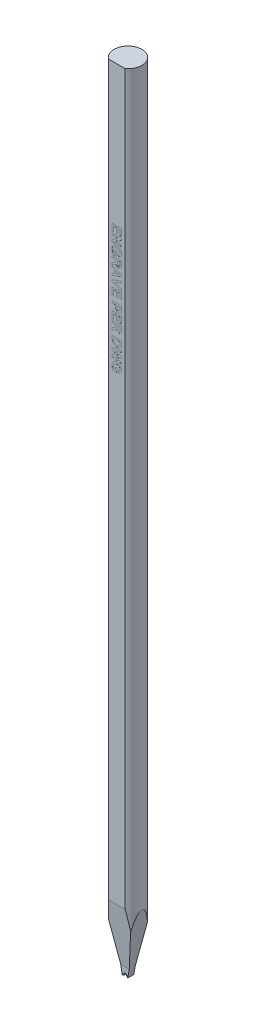
from build123d import *

# Parameters (mm, degrees)
SKETCH_TL_CUTTING_R       = 1.4986
TL_CUTTING_DEPTH          = 85.4964
SKETCH_TDF_GRINDING_W     = 3.0172
SKETCH_TDF_GRINDING_H     = 3.0172
TDF_GRINDING_DEPTH        = 86.522663762
ENGRAVING_DEPTH           = 0.005
VW_VR_GRINDING_DEPTH      = 1.5086
VW_VR_GRINDING_DEPTH_BACK = 1.5086
ISA_GRINDING_DEPTH        = 1.5086
ISA_GRINDING_DEPTH_BACK   = 1.5086
PRE_FRX_BRX_DEPTH         = 1.5086
PRE_FRX_BRX_DEPTH_BACK    = 1.5086
SKETCH_PRE_FRX_BRX_W      = 1.18348
SKETCH_PRE_FRX_BRX_H      = 0.89916
FR_EDM_R                  = 0.14986
BR_EDM_R                  = 0.14986
FA_BA_GRINDING_DEPTH      = 1.5086
FA_BA_GRINDING_DEPTH_BACK = 1.5086


with BuildPart() as part:
    # sketch_TL_cutting → TL_cutting (new body)
    with BuildSketch(Plane(origin=(0, 0, 0), x_dir=(1, 0, 0), z_dir=(0, 1, 0))):
        Circle(SKETCH_TL_CUTTING_R)
    extrude(amount=TL_CUTTING_DEPTH)

    # sketch_TDF_grinding → TDF_grinding (cut, through all)
    with BuildSketch(Plane(origin=(0, 0, 0), x_dir=(1, 0, 0), z_dir=(0, 1, 0))):
        with Locations((0, -2.71002)):
            Rectangle(SKETCH_TDF_GRINDING_W, SKETCH_TDF_GRINDING_H)
    extrude(amount=TDF_GRINDING_DEPTH, mode=Mode.SUBTRACT)

    # sketch_engraving → engraving (cut)
    # profile 1 of 13: a face of its own
    with BuildSketch(Plane.XY.offset(1.20142)):
        Polygon((-0.5, 70.393835897), (0.5, 70.393835897), (0.5, 69.650246154), (0.333333333, 69.650246154), (0.333333333, 70.201528205), (0.115384615, 70.201528205), (0.115384615, 69.688707692), (-0.051282051, 69.688707692), (-0.051282051, 70.201528205), (-0.333333333, 70.201528205), (-0.333333333, 69.637425641), (-0.5, 69.637425641), align=None)
    # profile 2 of 13: a face of its own
    with BuildSketch(Plane.XY.offset(1.20142)):
        Polygon((-0.5, 69.470758974), (0.5, 69.470758974), (0.5, 69.2698375), (-0.157451923, 68.868194872), (0.5, 68.868194872), (0.5, 68.675887179), (-0.5, 68.675887179), (-0.5, 68.88301859), (0.147035256, 69.278451282), (-0.5, 69.278451282), align=None)
    # profile 3 of 13: a face of its own
    with BuildSketch(Plane.XY.offset(1.20142)):
        with BuildLine():
            Line((-0.128205128, 68.022041026), (0.038461538, 68.022041026))
            Line((0.038461538, 68.022041026), (0.038461538, 67.58614359))
            Line((0.038461538, 67.58614359), (-0.36338141, 67.58614359))
            add(Edge.make_bspline(
                [(-0.36338141, 67.58614359), (-0.368321434, 67.591629605), (-0.378419843, 67.602844131), (-0.392661125, 67.621141895), (-0.406257259, 67.64128601), (-0.4194836, 67.6631547), (-0.432233696, 67.686793223), (-0.444685123, 67.712107295), (-0.45671611, 67.739143622), (-0.471787381, 67.777376941), (-0.488186169, 67.826591061), (-0.502445448, 67.886756306), (-0.511191227, 67.947397498), (-0.512277771, 67.987958306), (-0.512820513, 68.00821891)],
                knots=[0, 0, 0, 0, 0.581799769, 1.189316438, 1.825828404, 2.496525428, 3.203088405, 3.942228803, 4.719818701, 5.534979611, 7.181138583, 8.803804008, 10.403462225, 12, 12, 12, 12], degree=3))
            add(Edge.make_bspline(
                [(-0.512820513, 68.00821891), (-0.512629241, 68.020911396), (-0.512252188, 68.045932062), (-0.509233571, 68.082870349), (-0.504017902, 68.118587455), (-0.496780719, 68.153019967), (-0.487836372, 68.186270877), (-0.476607913, 68.218223396), (-0.463065488, 68.248843299), (-0.447986133, 68.278359812), (-0.430657849, 68.306212408), (-0.411724289, 68.332456254), (-0.390891397, 68.356836635), (-0.36853351, 68.379565448), (-0.344060025, 68.400214033), (-0.318106216, 68.419295872), (-0.290219674, 68.436354268), (-0.260879177, 68.45168079), (-0.230317098, 68.465310173), (-0.198781008, 68.476812477), (-0.166726875, 68.486896153), (-0.134042675, 68.495183938), (-0.10062201, 68.501270885), (-0.066619552, 68.50600276), (-0.031822841, 68.508544234), (-0.008417054, 68.508993556), (0.003405449, 68.509220513)],
                knots=[0, 0, 0, 0, 1.124897971, 2.217508473, 3.282174662, 4.322209414, 5.334422951, 6.332119154, 7.320662553, 8.300074908, 9.267468154, 10.225199689, 11.165658754, 12.107290334, 13.047749399, 14.00069605, 14.959944213, 15.942088746, 16.933021067, 17.923599838, 18.915715637, 19.910475908, 20.909926025, 21.925232038, 22.952013513, 24, 24, 24, 24], degree=3))
            add(Edge.make_bspline(
                [(0.003405449, 68.509220513), (0.016165747, 68.509036614), (0.041321811, 68.508674069), (0.078501182, 68.505544425), (0.114594914, 68.50069647), (0.149519517, 68.493301478), (0.183523729, 68.484448027), (0.216299841, 68.473103339), (0.248180515, 68.460149892), (0.278688999, 68.444865774), (0.308028284, 68.427983202), (0.335510174, 68.408799631), (0.361403632, 68.38798003), (0.385591047, 68.365337199), (0.407627145, 68.340498237), (0.428063784, 68.313972539), (0.447146094, 68.28577769), (0.457908016, 68.265600967), (0.463341346, 68.255414423)],
                knots=[0, 0, 0, 0, 1.105132952, 2.178694671, 3.229818344, 4.257558797, 5.269123684, 6.27148554, 7.259679084, 8.247804916, 9.224967877, 10.189258471, 11.147685264, 12.101072275, 13.055511435, 14.02039165, 15.000562851, 16, 16, 16, 16], degree=3))
            add(Edge.make_bspline(
                [(0.463341346, 68.255414423), (0.467347168, 68.247327072), (0.475455657, 68.230956849), (0.485329628, 68.204883756), (0.494054347, 68.177516179), (0.500719187, 68.148534703), (0.506115234, 68.118248224), (0.510216979, 68.086507147), (0.512307439, 68.053252939), (0.512647258, 68.030590515), (0.512820513, 68.019036218)],
                knots=[0, 0, 0, 0, 0.887950456, 1.797368171, 2.741221183, 3.713797788, 4.722103116, 5.768966405, 6.862521341, 8, 8, 8, 8], degree=3))
            add(Edge.make_bspline(
                [(0.512820513, 68.019036218), (0.512598613, 68.004138718), (0.512167059, 67.975165835), (0.508571106, 67.932925541), (0.502373597, 67.893171904), (0.493837942, 67.855849565), (0.482863355, 67.821038928), (0.469371425, 67.788799918), (0.453633675, 67.75893466), (0.435019378, 67.731875716), (0.414494937, 67.707073149), (0.392035387, 67.68459168), (0.367607461, 67.664422262), (0.341334074, 67.646551549), (0.313106625, 67.631120198), (0.283182558, 67.617852182), (0.251334696, 67.606931), (0.22921692, 67.601653034), (0.217948718, 67.598964103)],
                knots=[0, 0, 0, 0, 1.271135529, 2.472123572, 3.614091059, 4.701890498, 5.736279567, 6.724681829, 7.680621489, 8.611506429, 9.52200816, 10.424540711, 11.318996785, 12.221421405, 13.131851814, 14.060431888, 15.011860567, 16, 16, 16, 16], degree=3))
            Line((0.217948718, 67.598964103), (0.179487179, 67.791271795))
            add(Edge.make_bspline(
                [(0.179487179, 67.791271795), (0.185798707, 67.793174377), (0.198251232, 67.796928136), (0.216108293, 67.804234712), (0.232994438, 67.812552834), (0.248643132, 67.822379827), (0.263649233, 67.832817482), (0.277161531, 67.845087665), (0.290187329, 67.857994684), (0.301701762, 67.87248584), (0.312086782, 67.887924395), (0.321450083, 67.904145863), (0.329043783, 67.921514205), (0.335153652, 67.939786828), (0.340342569, 67.958874233), (0.343533767, 67.979025571), (0.345940549, 68.00001453), (0.346081986, 68.014354556), (0.346153846, 68.021640385)],
                knots=[0, 0, 0, 0, 1.027780279, 2.027791312, 3.006028774, 3.96000864, 4.908113241, 5.852721087, 6.802883308, 7.765918715, 8.733730415, 9.704005314, 10.683351261, 11.68471758, 12.707948499, 13.764514378, 14.864202456, 16, 16, 16, 16], degree=3))
            add(Edge.make_bspline(
                [(0.346153846, 68.021640385), (0.345859633, 68.032667741), (0.34528545, 68.054188568), (0.341538784, 68.085606107), (0.334873123, 68.115245672), (0.325679114, 68.14318477), (0.313877959, 68.169474621), (0.299029501, 68.193759968), (0.282012344, 68.216645501), (0.262039987, 68.237479978), (0.239645267, 68.256374481), (0.214561065, 68.272731053), (0.186868462, 68.28634783), (0.156706511, 68.297500746), (0.124073954, 68.306380847), (0.088855272, 68.312404995), (0.051104495, 68.316341063), (0.02505068, 68.316718323), (0.01161859, 68.316912821)],
                knots=[0, 0, 0, 0, 1.043810997, 2.037086103, 2.989314757, 3.91471467, 4.817033861, 5.710208705, 6.603920097, 7.511448416, 8.435617211, 9.371747005, 10.338444094, 11.350425613, 12.411431869, 13.5347293, 14.729025275, 16, 16, 16, 16], degree=3))
            add(Edge.make_bspline(
                [(0.01161859, 68.316912821), (-0.002813331, 68.316710147), (-0.03086261, 68.316316238), (-0.071503034, 68.312481337), (-0.109371212, 68.306183116), (-0.14440027, 68.297115757), (-0.176807311, 68.285808494), (-0.206438048, 68.271828966), (-0.233109204, 68.25502113), (-0.256980675, 68.235958295), (-0.278169336, 68.214921484), (-0.296147735, 68.191858524), (-0.31184176, 68.167600317), (-0.32420794, 68.141460517), (-0.33413508, 68.113912028), (-0.341078682, 68.084685999), (-0.345395871, 68.053887729), (-0.345897627, 68.032806176), (-0.346153846, 68.022041026)],
                knots=[0, 0, 0, 0, 1.31821493, 2.562027667, 3.72541598, 4.821825939, 5.863743127, 6.857000185, 7.808227391, 8.737146514, 9.643023621, 10.529087527, 11.404035307, 12.277173472, 13.164790074, 14.074766194, 15.016892606, 16, 16, 16, 16], degree=3))
            add(Edge.make_bspline(
                [(-0.346153846, 68.022041026), (-0.345850315, 68.011137735), (-0.34524035, 67.989226847), (-0.340086045, 67.956405767), (-0.332449955, 67.923405514), (-0.321065283, 67.891013163), (-0.307937779, 67.859626456), (-0.292687307, 67.830460255), (-0.276962331, 67.803067677), (-0.264654274, 67.7865552), (-0.258613782, 67.778451282)],
                knots=[0, 0, 0, 0, 0.993779204, 1.997065276, 3.023588959, 4.078879359, 5.123947549, 6.123456565, 7.079038607, 8, 8, 8, 8], degree=3))
            Line((-0.258613782, 67.778451282), (-0.128205128, 67.778451282))
            Line((-0.128205128, 67.778451282), (-0.128205128, 68.022041026))
        make_face()
    # profile 4 of 13: a face of its own
    with BuildSketch(Plane.XY.offset(1.20142)):
        with BuildLine():
            Line((-0.5, 67.393835897), (0.5, 67.393835897))
            Line((0.5, 67.393835897), (0.5, 66.974164423))
            add(Edge.make_bspline(
                [(0.5, 66.974164423), (0.499921351, 66.961410201), (0.499769781, 66.936830481), (0.498665723, 66.901283268), (0.496349389, 66.868501265), (0.493735057, 66.838336822), (0.489890849, 66.810877094), (0.485377151, 66.786056079), (0.480042652, 66.763953829), (0.473762142, 66.7443266), (0.46640441, 66.726499938), (0.457825047, 66.709835326), (0.447696774, 66.694175272), (0.436444977, 66.679314477), (0.424039539, 66.665195254), (0.410155618, 66.652203274), (0.394999014, 66.640112567), (0.378696089, 66.628932781), (0.361318758, 66.619084096), (0.343425117, 66.610084982), (0.324824746, 66.602759364), (0.305605269, 66.59670847), (0.285808412, 66.591874923), (0.265383845, 66.588520032), (0.244368538, 66.586425611), (0.230173307, 66.586238641), (0.222956731, 66.58614359)],
                knots=[0, 0, 0, 0, 1.675792322, 3.229558513, 4.671612708, 5.993327294, 7.206773438, 8.313218507, 9.306927966, 10.191988363, 11.018030861, 11.838135071, 12.650980327, 13.465150207, 14.285535933, 15.117196726, 15.959844754, 16.83101188, 17.711363548, 18.582398133, 19.460517458, 20.334551361, 21.228266118, 22.135486512, 23.052118027, 24, 24, 24, 24], degree=3))
            add(Edge.make_bspline(
                [(0.222956731, 66.58614359), (0.213865176, 66.58631771), (0.196097772, 66.586657988), (0.170067915, 66.589859374), (0.145135532, 66.594460931), (0.121515047, 66.601574247), (0.099028777, 66.610418829), (0.077834712, 66.621224821), (0.057734109, 66.633977691), (0.039011166, 66.648743067), (0.021628172, 66.665461702), (0.005964946, 66.684227919), (-0.008142217, 66.704917705), (-0.020271369, 66.727700383), (-0.030960543, 66.752183224), (-0.039742833, 66.778688699), (-0.046961528, 66.80708005), (-0.050349413, 66.826834525), (-0.052083333, 66.836944872)],
                knots=[0, 0, 0, 0, 1.059179627, 2.069928931, 3.052909591, 4.01082991, 4.940120368, 5.865982481, 6.779263376, 7.710344595, 8.640547144, 9.585223395, 10.554458868, 11.553878165, 12.589111246, 13.664634927, 14.804759383, 16, 16, 16, 16], degree=3))
            add(Edge.make_bspline(
                [(-0.052083333, 66.836944872), (-0.058543192, 66.827154557), (-0.071157156, 66.808037315), (-0.092244136, 66.781740986), (-0.113935974, 66.757782324), (-0.13350323, 66.739795798), (-0.150629326, 66.725961316), (-0.165615492, 66.714828495), (-0.182859981, 66.702817912), (-0.202374991, 66.69004991), (-0.22398696, 66.676146224), (-0.248026974, 66.661624206), (-0.274260457, 66.646179885), (-0.292585876, 66.635796031), (-0.302083333, 66.630414423)],
                knots=[0, 0, 0, 0, 1.285482994, 2.510122655, 3.691653098, 4.826411195, 5.419869803, 6.105175889, 6.872935239, 7.723789235, 8.662129684, 9.690525463, 10.803075916, 12, 12, 12, 12], degree=3))
            Line((-0.302083333, 66.630414423), (-0.5, 66.509220513))
            Line((-0.5, 66.509220513), (-0.5, 66.733980128))
            Line((-0.5, 66.733980128), (-0.273036859, 66.876207692))
            add(Edge.make_bspline(
                [(-0.273036859, 66.876207692), (-0.263945443, 66.882737401), (-0.24658806, 66.895203957), (-0.221949287, 66.91323509), (-0.199893124, 66.929636608), (-0.1805544, 66.944427372), (-0.163731826, 66.957427709), (-0.149845803, 66.969082343), (-0.138230202, 66.978819639), (-0.126725879, 66.989854127), (-0.114887633, 67.002680533), (-0.103494307, 67.018542305), (-0.094238036, 67.034723543), (-0.087286311, 67.05222809), (-0.082478883, 67.072519627), (-0.079343719, 67.096879092), (-0.077067211, 67.126032144), (-0.076973557, 67.147102303), (-0.076923077, 67.158459295)],
                knots=[0, 0, 0, 0, 1.465382114, 2.797715724, 3.99708711, 5.063614826, 5.985194575, 6.779875669, 7.43696127, 7.968700361, 8.866038685, 9.717629234, 10.520014012, 11.30082289, 12.174340694, 13.242479345, 14.513673363, 16, 16, 16, 16], degree=3))
            Line((-0.076923077, 67.158459295), (-0.076923077, 67.201528205))
            Line((-0.076923077, 67.201528205), (-0.5, 67.201528205))
            Line((-0.5, 67.201528205), (-0.5, 67.393835897))
        make_face()
        with BuildLine():
            Line((0.08974359, 67.201528205), (0.08974359, 67.046680449))
            add(Edge.make_bspline(
                [(0.08974359, 67.046680449), (0.089768957, 67.0347274), (0.089817287, 67.011954821), (0.090527354, 66.979571991), (0.091115821, 66.950709113), (0.09265079, 66.925409153), (0.094114881, 66.903619334), (0.096069001, 66.885367128), (0.09836301, 66.870628848), (0.101931469, 66.855907986), (0.108148092, 66.840828202), (0.117003495, 66.824758518), (0.128487921, 66.811015466), (0.141777239, 66.799142986), (0.157332372, 66.789978485), (0.174706183, 66.783257484), (0.193862841, 66.779243774), (0.20724563, 66.778720802), (0.214142628, 66.778451282)],
                knots=[0, 0, 0, 0, 1.698120923, 3.235207303, 4.601799022, 5.7989489, 6.835765357, 7.704239165, 8.40605236, 8.953649664, 9.852072573, 10.714567413, 11.550246753, 12.383769498, 13.234656382, 14.099651817, 15.020630301, 16, 16, 16, 16], degree=3))
            add(Edge.make_bspline(
                [(0.214142628, 66.778451282), (0.221852989, 66.77878604), (0.236728888, 66.7794319), (0.257822961, 66.784686949), (0.27662771, 66.793434428), (0.292813882, 66.805923618), (0.306623576, 66.82152236), (0.317392842, 66.840246681), (0.325576055, 66.861691747), (0.328565774, 66.877145804), (0.330128205, 66.885222115)],
                knots=[0, 0, 0, 0, 1.062451802, 2.049829439, 2.976851779, 3.903462222, 4.849641532, 5.832195941, 6.867102576, 8, 8, 8, 8], degree=3))
            add(Edge.make_bspline(
                [(0.330128205, 66.885222115), (0.330421459, 66.887891011), (0.331116534, 66.894216853), (0.331562949, 66.905387541), (0.332249138, 66.919670698), (0.332529569, 66.937239208), (0.333021138, 66.957936115), (0.333111403, 66.981843719), (0.333399792, 67.008886063), (0.333356297, 67.027983752), (0.333333333, 67.038066667)],
                knots=[0, 0, 0, 0, 0.42127143, 0.998501726, 1.753681744, 2.66564073, 3.755712164, 5.002818897, 6.417592707, 8, 8, 8, 8], degree=3))
            Line((0.333333333, 67.038066667), (0.333333333, 67.201528205))
            Line((0.333333333, 67.201528205), (0.08974359, 67.201528205))
        make_face(mode=Mode.SUBTRACT)
    # profile 5 of 13: a face of its own
    with BuildSketch(Plane.XY.offset(1.20142)):
        Polygon((-0.5, 65.534861538), (-0.5, 65.738787821), (-0.269230769, 65.823122756), (-0.269230769, 66.206936859), (-0.5, 66.291271795), (-0.5, 66.4964), (0.5, 66.118395192), (0.5, 65.914669231), align=None)
        Polygon((-0.102564103, 65.884220513), (0.256410256, 66.015630769), (-0.102564103, 66.146640385), align=None, mode=Mode.SUBTRACT)
    # profile 6 of 13: a face of its own
    with BuildSketch(Plane.XY.offset(1.20142)):
        Polygon((-0.5, 65.126608333), (0.5, 65.4964), (0.5, 65.293275), (-0.243589744, 65.028451282), (0.5, 64.764629167), (0.5, 64.560502564), (-0.5, 64.928891987), align=None)
    # profile 7 of 13: a face of its own
    with BuildSketch(Plane.XY.offset(1.20142)):
        Polygon((-0.5, 64.470758974), (0.5, 64.470758974), (0.5, 63.727169231), (0.333333333, 63.727169231), (0.333333333, 64.278451282), (0.115384615, 64.278451282), (0.115384615, 63.765630769), (-0.051282051, 63.765630769), (-0.051282051, 64.278451282), (-0.333333333, 64.278451282), (-0.333333333, 63.714348718), (-0.5, 63.714348718), align=None)
    # profile 8 of 13: a face of its own
    with BuildSketch(Plane.XY.offset(1.20142)):
        with BuildLine():
            Line((-0.5, 63.163066667), (0.5, 63.163066667))
            Line((0.5, 63.163066667), (0.5, 62.843154808))
            add(Edge.make_bspline(
                [(0.5, 62.843154808), (0.4999852, 62.828664455), (0.499956962, 62.801016693), (0.499104777, 62.761484062), (0.497929464, 62.725889855), (0.496434625, 62.694222803), (0.494248137, 62.666566334), (0.491629455, 62.642858956), (0.488933209, 62.622991744), (0.486060508, 62.611234128), (0.484775641, 62.605975321)],
                knots=[0, 0, 0, 0, 1.460492613, 2.786636817, 3.985312262, 5.05006335, 5.98179196, 6.7807735, 7.454678796, 8, 8, 8, 8], degree=3))
            add(Edge.make_bspline(
                [(0.484775641, 62.605975321), (0.482781564, 62.598981959), (0.478823789, 62.585101776), (0.470386441, 62.565215803), (0.460608006, 62.54604887), (0.448953875, 62.527841805), (0.435630967, 62.510532663), (0.420747869, 62.494070188), (0.404237636, 62.478365844), (0.386131953, 62.463639765), (0.366525691, 62.450143742), (0.345376234, 62.438512401), (0.322847402, 62.428651925), (0.298873329, 62.420727517), (0.273610941, 62.414175617), (0.246834559, 62.409993024), (0.218752408, 62.406969504), (0.199528035, 62.4067623), (0.189703526, 62.40665641)],
                knots=[0, 0, 0, 0, 0.907183394, 1.800546498, 2.691728384, 3.591410291, 4.495216108, 5.416087871, 6.359626967, 7.337496937, 8.327236581, 9.327316132, 10.346534403, 11.393207653, 12.477041209, 13.600953845, 14.773980723, 16, 16, 16, 16], degree=3))
            add(Edge.make_bspline(
                [(0.189703526, 62.40665641), (0.174784734, 62.406964918), (0.146065241, 62.407558813), (0.104894137, 62.414208263), (0.067280604, 62.424341168), (0.03361575, 62.439182122), (0.003633111, 62.457195209), (-0.023091697, 62.477363014), (-0.046492635, 62.499846245), (-0.066210989, 62.524425478), (-0.082434, 62.550356803), (-0.096247437, 62.576355341), (-0.106871469, 62.602746515), (-0.11149992, 62.62074078), (-0.113782051, 62.629613141)],
                knots=[0, 0, 0, 0, 1.312446177, 2.526530956, 3.662051072, 4.733637382, 5.754065268, 6.735959421, 7.675686778, 8.604015004, 9.502732733, 10.365317746, 11.193993632, 12, 12, 12, 12], degree=3))
            add(Edge.make_bspline(
                [(-0.113782051, 62.629613141), (-0.114986663, 62.635945752), (-0.11752584, 62.649294139), (-0.120056937, 62.670463883), (-0.122858586, 62.693603561), (-0.124685978, 62.718808347), (-0.126397255, 62.74604775), (-0.127205205, 62.775311194), (-0.128178621, 62.806556857), (-0.128196112, 62.828063031), (-0.128205128, 62.839148397)],
                knots=[0, 0, 0, 0, 0.735353946, 1.55003838, 2.431865514, 3.394945452, 4.432993119, 5.54609699, 6.735134699, 8, 8, 8, 8], degree=3))
            Line((-0.128205128, 62.839148397), (-0.128205128, 62.970758974))
            Line((-0.128205128, 62.970758974), (-0.5, 62.970758974))
            Line((-0.5, 62.970758974), (-0.5, 63.163066667))
        make_face()
        with BuildLine():
            Line((0.333333333, 62.970758974), (0.038461538, 62.970758974))
            Line((0.038461538, 62.970758974), (0.038461538, 62.855374359))
            add(Edge.make_bspline(
                [(0.038461538, 62.855374359), (0.038474423, 62.845424233), (0.038499073, 62.82638839), (0.039383856, 62.799076178), (0.040463899, 62.774353138), (0.04225159, 62.752167611), (0.044607724, 62.732653517), (0.047425958, 62.715680173), (0.050450217, 62.701227797), (0.055461898, 62.68559952), (0.063570342, 62.668889767), (0.075224213, 62.651045715), (0.089157789, 62.635369737), (0.105522293, 62.622325245), (0.123704204, 62.611905583), (0.143517189, 62.604445099), (0.164632877, 62.59962787), (0.179260262, 62.599187861), (0.186698718, 62.598964103)],
                knots=[0, 0, 0, 0, 1.411705958, 2.700771114, 3.876961699, 4.922619712, 5.858038221, 6.66485904, 7.363650596, 7.950905807, 8.989198271, 9.987739806, 10.967313358, 11.951275539, 12.944273208, 13.927870418, 14.946261014, 16, 16, 16, 16], degree=3))
            add(Edge.make_bspline(
                [(0.186698718, 62.598964103), (0.195758642, 62.599279017), (0.213324639, 62.599889596), (0.238341551, 62.60662257), (0.261044702, 62.617010781), (0.280727694, 62.631862972), (0.297279472, 62.64980407), (0.31105114, 62.669969116), (0.320688658, 62.692788742), (0.32442284, 62.708938921), (0.326322115, 62.717153205)],
                knots=[0, 0, 0, 0, 1.085904563, 2.105425768, 3.088705091, 4.068969419, 5.045188284, 6.010769642, 6.988240112, 8, 8, 8, 8], degree=3))
            add(Edge.make_bspline(
                [(0.326322115, 62.717153205), (0.326887477, 62.720687999), (0.328142404, 62.728534146), (0.329452077, 62.741576039), (0.330643223, 62.757004601), (0.331621189, 62.774838428), (0.332385732, 62.795006833), (0.333055661, 62.81757634), (0.333109481, 62.842487507), (0.333256648, 62.85991512), (0.333333333, 62.868996154)],
                knots=[0, 0, 0, 0, 0.564603001, 1.253243608, 2.066786758, 3.005752288, 4.070476343, 5.250658742, 6.567396469, 8, 8, 8, 8], degree=3))
            Line((0.333333333, 62.868996154), (0.333333333, 62.970758974))
        make_face(mode=Mode.SUBTRACT)
    # profile 9 of 13: a face of its own
    with BuildSketch(Plane.XY.offset(1.20142)):
        Polygon((-0.5, 62.239989744), (0.5, 62.239989744), (0.5, 61.4964), (0.333333333, 61.4964), (0.333333333, 62.047682051), (0.115384615, 62.047682051), (0.115384615, 61.534861538), (-0.051282051, 61.534861538), (-0.051282051, 62.047682051), (-0.333333333, 62.047682051), (-0.333333333, 61.483579487), (-0.5, 61.483579487), align=None)
    # profile 10 of 13: a face of its own
    with BuildSketch(Plane.XY.offset(1.20142)):
        with BuildLine():
            Line((-0.5, 61.316912821), (0.5, 61.316912821))
            Line((0.5, 61.316912821), (0.5, 60.897241346))
            add(Edge.make_bspline(
                [(0.5, 60.897241346), (0.499921351, 60.884487124), (0.499769781, 60.859907404), (0.498665723, 60.824360191), (0.496349389, 60.791578188), (0.493735057, 60.761413745), (0.489890849, 60.733954017), (0.485377151, 60.709133002), (0.480042652, 60.687030752), (0.473762142, 60.667403523), (0.46640441, 60.649576861), (0.457825047, 60.632912249), (0.447696774, 60.617252195), (0.436444977, 60.6023914), (0.424039539, 60.588272178), (0.410155618, 60.575280198), (0.394999014, 60.56318949), (0.378696089, 60.552009704), (0.361318758, 60.542161019), (0.343425117, 60.533161905), (0.324824746, 60.525836287), (0.305605269, 60.519785393), (0.285808412, 60.514951846), (0.265383845, 60.511596956), (0.244368538, 60.509502534), (0.230173307, 60.509315564), (0.222956731, 60.509220513)],
                knots=[0, 0, 0, 0, 1.675792322, 3.229558513, 4.671612708, 5.993327294, 7.206773438, 8.313218507, 9.306927966, 10.191988363, 11.018030861, 11.838135071, 12.650980327, 13.465150207, 14.285535933, 15.117196726, 15.959844754, 16.83101188, 17.711363548, 18.582398133, 19.460517458, 20.334551361, 21.228266118, 22.135486512, 23.052118027, 24, 24, 24, 24], degree=3))
            add(Edge.make_bspline(
                [(0.222956731, 60.509220513), (0.213865176, 60.509394633), (0.196097772, 60.509734911), (0.170067915, 60.512936297), (0.145135532, 60.517537854), (0.121515047, 60.52465117), (0.099028777, 60.533495752), (0.077834712, 60.544301744), (0.057734109, 60.557054614), (0.039011166, 60.57181999), (0.021628172, 60.588538625), (0.005964946, 60.607304843), (-0.008142217, 60.627994628), (-0.020271369, 60.650777306), (-0.030960543, 60.675260147), (-0.039742833, 60.701765622), (-0.046961528, 60.730156973), (-0.050349413, 60.749911448), (-0.052083333, 60.760021795)],
                knots=[0, 0, 0, 0, 1.059179627, 2.069928931, 3.052909591, 4.01082991, 4.940120368, 5.865982481, 6.779263376, 7.710344595, 8.640547144, 9.585223395, 10.554458868, 11.553878165, 12.589111246, 13.664634927, 14.804759383, 16, 16, 16, 16], degree=3))
            add(Edge.make_bspline(
                [(-0.052083333, 60.760021795), (-0.058543192, 60.75023148), (-0.071157156, 60.731114238), (-0.092244136, 60.704817909), (-0.113935974, 60.680859247), (-0.13350323, 60.662872722), (-0.150629326, 60.649038239), (-0.165615492, 60.637905418), (-0.182859981, 60.625894835), (-0.202374991, 60.613126833), (-0.22398696, 60.599223147), (-0.248026974, 60.584701129), (-0.274260457, 60.569256808), (-0.292585876, 60.558872954), (-0.302083333, 60.553491346)],
                knots=[0, 0, 0, 0, 1.285482994, 2.510122655, 3.691653098, 4.826411195, 5.419869803, 6.105175889, 6.872935239, 7.723789235, 8.662129684, 9.690525463, 10.803075916, 12, 12, 12, 12], degree=3))
            Line((-0.302083333, 60.553491346), (-0.5, 60.432297436))
            Line((-0.5, 60.432297436), (-0.5, 60.657057051))
            Line((-0.5, 60.657057051), (-0.273036859, 60.799284615))
            add(Edge.make_bspline(
                [(-0.273036859, 60.799284615), (-0.263945443, 60.805814324), (-0.24658806, 60.81828088), (-0.221949287, 60.836312013), (-0.199893124, 60.852713531), (-0.1805544, 60.867504295), (-0.163731826, 60.880504632), (-0.149845803, 60.892159266), (-0.138230202, 60.901896562), (-0.126725879, 60.91293105), (-0.114887633, 60.925757456), (-0.103494307, 60.941619228), (-0.094238036, 60.957800466), (-0.087286311, 60.975305013), (-0.082478883, 60.995596551), (-0.079343719, 61.019956015), (-0.077067211, 61.049109067), (-0.076973557, 61.070179226), (-0.076923077, 61.081536218)],
                knots=[0, 0, 0, 0, 1.465382114, 2.797715724, 3.99708711, 5.063614826, 5.985194575, 6.779875669, 7.43696127, 7.968700361, 8.866038685, 9.717629234, 10.520014012, 11.30082289, 12.174340694, 13.242479345, 14.513673363, 16, 16, 16, 16], degree=3))
            Line((-0.076923077, 61.081536218), (-0.076923077, 61.124605128))
            Line((-0.076923077, 61.124605128), (-0.5, 61.124605128))
            Line((-0.5, 61.124605128), (-0.5, 61.316912821))
        make_face()
        with BuildLine():
            Line((0.08974359, 61.124605128), (0.08974359, 60.969757372))
            add(Edge.make_bspline(
                [(0.08974359, 60.969757372), (0.089768957, 60.957804323), (0.089817287, 60.935031744), (0.090527354, 60.902648914), (0.091115821, 60.873786036), (0.09265079, 60.848486076), (0.094114881, 60.826696257), (0.096069001, 60.808444051), (0.09836301, 60.793705771), (0.101931469, 60.778984909), (0.108148092, 60.763905125), (0.117003495, 60.747835441), (0.128487921, 60.734092389), (0.141777239, 60.722219909), (0.157332372, 60.713055408), (0.174706183, 60.706334407), (0.193862841, 60.702320697), (0.20724563, 60.701797726), (0.214142628, 60.701528205)],
                knots=[0, 0, 0, 0, 1.698120923, 3.235207303, 4.601799022, 5.7989489, 6.835765357, 7.704239165, 8.40605236, 8.953649664, 9.852072573, 10.714567413, 11.550246753, 12.383769498, 13.234656382, 14.099651817, 15.020630301, 16, 16, 16, 16], degree=3))
            add(Edge.make_bspline(
                [(0.214142628, 60.701528205), (0.221852989, 60.701862963), (0.236728888, 60.702508823), (0.257822961, 60.707763872), (0.27662771, 60.716511351), (0.292813882, 60.729000541), (0.306623576, 60.744599283), (0.317392842, 60.763323604), (0.325576055, 60.78476867), (0.328565774, 60.800222727), (0.330128205, 60.808299038)],
                knots=[0, 0, 0, 0, 1.062451802, 2.049829439, 2.976851779, 3.903462222, 4.849641532, 5.832195941, 6.867102576, 8, 8, 8, 8], degree=3))
            add(Edge.make_bspline(
                [(0.330128205, 60.808299038), (0.330421459, 60.810967934), (0.331116534, 60.817293776), (0.331562949, 60.828464464), (0.332249138, 60.842747621), (0.332529569, 60.860316131), (0.333021138, 60.881013038), (0.333111403, 60.904920642), (0.333399792, 60.931962986), (0.333356297, 60.951060675), (0.333333333, 60.96114359)],
                knots=[0, 0, 0, 0, 0.42127143, 0.998501726, 1.753681744, 2.66564073, 3.755712164, 5.002818897, 6.417592707, 8, 8, 8, 8], degree=3))
            Line((0.333333333, 60.96114359), (0.333333333, 61.124605128))
            Line((0.333333333, 61.124605128), (0.08974359, 61.124605128))
        make_face(mode=Mode.SUBTRACT)
    # profile 11 of 13: a face of its own
    with BuildSketch(Plane.XY.offset(1.20142)):
        with BuildLine():
            Line((0.5, 59.932297436), (0.5, 59.565510577))
            add(Edge.make_bspline(
                [(0.5, 59.565510577), (0.500005193, 59.555493032), (0.500015306, 59.535986546), (0.498840892, 59.507677527), (0.497659587, 59.481204956), (0.495294873, 59.456644813), (0.492816233, 59.433911894), (0.489678088, 59.412965404), (0.485656212, 59.393937663), (0.482484481, 59.381938781), (0.480969551, 59.376207692)],
                knots=[0, 0, 0, 0, 1.259756885, 2.453039283, 3.563158368, 4.591894114, 5.55549294, 6.43918076, 7.254497783, 8, 8, 8, 8], degree=3))
            add(Edge.make_bspline(
                [(0.480969551, 59.376207692), (0.478637325, 59.369038716), (0.474014881, 59.354829893), (0.465827813, 59.33397684), (0.455960096, 59.314142941), (0.445111978, 59.29486828), (0.432903728, 59.276596015), (0.419595761, 59.258881335), (0.404753223, 59.242248264), (0.383633179, 59.220713601), (0.35420815, 59.196288717), (0.315375005, 59.170458181), (0.272594656, 59.148720476), (0.234409605, 59.133529103), (0.20183843, 59.123485004), (0.175754603, 59.116916602), (0.148301213, 59.111244929), (0.119383738, 59.106994754), (0.08913491, 59.103333367), (0.057465542, 59.100705699), (0.024383276, 59.099404712), (0.001870575, 59.099112956), (-0.009615385, 59.098964103)],
                knots=[0, 0, 0, 0, 0.745431882, 1.477436776, 2.212739876, 2.934276521, 3.663147754, 4.384200836, 5.123377481, 5.865761747, 7.365547505, 8.894711587, 10.468722596, 12.101948761, 12.951987285, 13.837595333, 14.760899389, 15.722756883, 16.726861385, 17.773652936, 18.864119771, 20, 20, 20, 20], degree=3))
            add(Edge.make_bspline(
                [(-0.009615385, 59.098964103), (-0.0294616, 59.099355507), (-0.067834928, 59.100112302), (-0.123301552, 59.105709673), (-0.17465514, 59.11500511), (-0.206804138, 59.124715536), (-0.222355769, 59.129412821)],
                knots=[0, 0, 0, 0, 1.103491527, 2.133638164, 3.0971734, 4, 4, 4, 4], degree=3))
            add(Edge.make_bspline(
                [(-0.222355769, 59.129412821), (-0.231274521, 59.132586465), (-0.248819098, 59.138829518), (-0.274127236, 59.149754394), (-0.298211673, 59.161558799), (-0.321053432, 59.174340646), (-0.342549771, 59.188164513), (-0.362636394, 59.203082107), (-0.381577746, 59.218862192), (-0.393236239, 59.230293951), (-0.399038462, 59.235983333)],
                knots=[0, 0, 0, 0, 1.090884612, 2.145940218, 3.175104604, 4.181306866, 5.161203701, 6.118658341, 7.063689906, 8, 8, 8, 8], degree=3))
            add(Edge.make_bspline(
                [(-0.399038462, 59.235983333), (-0.407300305, 59.245269607), (-0.424264154, 59.264336893), (-0.445652736, 59.297688411), (-0.464086504, 59.335563738), (-0.473760833, 59.362877629), (-0.478766026, 59.377008974)],
                knots=[0, 0, 0, 0, 0.912008655, 1.872605891, 2.89935344, 4, 4, 4, 4], degree=3))
            add(Edge.make_bspline(
                [(-0.478766026, 59.377008974), (-0.4805228, 59.382728948), (-0.484168894, 59.394600457), (-0.488062998, 59.413423906), (-0.492165475, 59.433518409), (-0.49463687, 59.455115685), (-0.497243066, 59.477991543), (-0.498706299, 59.502328283), (-0.49974511, 59.528041542), (-0.499913777, 59.545677636), (-0.5, 59.554693269)],
                knots=[0, 0, 0, 0, 0.799129865, 1.658552685, 2.566799617, 3.538529252, 4.561352959, 5.643373779, 6.795284424, 8, 8, 8, 8], degree=3))
            Line((-0.5, 59.554693269), (-0.5, 59.932297436))
            Line((-0.5, 59.932297436), (0.5, 59.932297436))
        make_face()
        with BuildLine():
            Line((0.333333333, 59.739989744), (-0.333333333, 59.739989744))
            Line((-0.333333333, 59.739989744), (-0.333333333, 59.581736538))
            add(Edge.make_bspline(
                [(-0.333333333, 59.581736538), (-0.333276671, 59.574591821), (-0.333167574, 59.560835511), (-0.332847006, 59.540929778), (-0.331979167, 59.522636576), (-0.331080228, 59.505860076), (-0.329595022, 59.490643952), (-0.328134266, 59.476921997), (-0.326090699, 59.464770593), (-0.324477534, 59.457265588), (-0.323717949, 59.453731731)],
                knots=[0, 0, 0, 0, 1.333384787, 2.567275092, 3.714769766, 4.750907381, 5.701951617, 6.567520054, 7.325492842, 8, 8, 8, 8], degree=3))
            add(Edge.make_bspline(
                [(-0.323717949, 59.453731731), (-0.321509316, 59.445455036), (-0.317207482, 59.429334219), (-0.307617456, 59.406698961), (-0.296048139, 59.386216969), (-0.282136533, 59.367545232), (-0.26455548, 59.350718131), (-0.242070693, 59.336354145), (-0.215254411, 59.323060653), (-0.189584523, 59.313957267), (-0.16665678, 59.307422874), (-0.147412959, 59.302999626), (-0.126593091, 59.299504053), (-0.104279343, 59.296497404), (-0.080500412, 59.29406796), (-0.055170426, 59.292556245), (-0.028320392, 59.29152449), (-0.009883527, 59.291357622), (-0.000400641, 59.291271795)],
                knots=[0, 0, 0, 0, 1.038686998, 2.023088296, 2.974059649, 3.888265163, 4.839857954, 5.909819677, 7.113156087, 8.466843969, 9.20827164, 10.006482943, 10.861893492, 11.769681931, 12.739021491, 13.762258324, 14.849031541, 16, 16, 16, 16], degree=3))
            add(Edge.make_bspline(
                [(-0.000400641, 59.291271795), (0.009082275, 59.291356962), (0.027452469, 59.291521946), (0.054102292, 59.292552126), (0.079033415, 59.294055325), (0.102276578, 59.296502152), (0.123864169, 59.299461918), (0.143813574, 59.302999353), (0.161996804, 59.307392884), (0.183589283, 59.313945973), (0.207947697, 59.323783458), (0.23429421, 59.337609661), (0.2571147, 59.353874863), (0.276689574, 59.372230019), (0.29287817, 59.393317031), (0.306422028, 59.416687832), (0.316938162, 59.442818741), (0.321416742, 59.461407779), (0.323717949, 59.470959295)],
                knots=[0, 0, 0, 0, 1.118059345, 2.165891593, 3.144157881, 4.062285166, 4.920717571, 5.712910489, 6.449981617, 7.12489426, 8.371943983, 9.541298068, 10.624898781, 11.666293176, 12.69306237, 13.747704633, 14.842713931, 16, 16, 16, 16], degree=3))
            add(Edge.make_bspline(
                [(0.323717949, 59.470959295), (0.324486218, 59.475093605), (0.326177652, 59.484195773), (0.328151987, 59.499300032), (0.329628909, 59.51708664), (0.331099472, 59.537515577), (0.331977905, 59.560565526), (0.332859431, 59.586271032), (0.333166326, 59.614655313), (0.333276065, 59.634487669), (0.333333333, 59.6448375)],
                knots=[0, 0, 0, 0, 0.578739524, 1.274162912, 2.095457587, 3.035141998, 4.093102578, 5.270121571, 6.575369351, 8, 8, 8, 8], degree=3))
            Line((0.333333333, 59.6448375), (0.333333333, 59.739989744))
        make_face(mode=Mode.SUBTRACT)
    # profile 12 of 13: a face of its own
    with BuildSketch(Plane.XY.offset(1.20142)):
        Polygon((-0.5, 58.795478526), (0.5, 59.034861538), (0.5, 58.837746154), (-0.186899038, 58.682297436), (0.5, 58.517834295), (0.5, 58.255414423), (-0.198517628, 58.092553846), (0.5, 57.937505769), (0.5, 57.739989744), (-0.5, 57.974965705), (-0.5, 58.213146795), (0.247596154, 58.387425641), (-0.5, 58.566311859), align=None)
    # profile 13 of 13: a face of its own
    with BuildSketch(Plane.XY.offset(1.20142)):
        with BuildLine():
            Line((-0.128205128, 57.175887179), (0.038461538, 57.175887179))
            Line((0.038461538, 57.175887179), (0.038461538, 56.739989744))
            Line((0.038461538, 56.739989744), (-0.36338141, 56.739989744))
            add(Edge.make_bspline(
                [(-0.36338141, 56.739989744), (-0.368321434, 56.745475759), (-0.378419843, 56.756690285), (-0.392661125, 56.774988049), (-0.406257259, 56.795132164), (-0.4194836, 56.817000854), (-0.432233696, 56.840639376), (-0.444685123, 56.865953449), (-0.45671611, 56.892989776), (-0.471787381, 56.931223095), (-0.488186169, 56.980437215), (-0.502445448, 57.04060246), (-0.511191227, 57.101243651), (-0.512277771, 57.14180446), (-0.512820513, 57.162065064)],
                knots=[0, 0, 0, 0, 0.581799769, 1.189316438, 1.825828404, 2.496525428, 3.203088405, 3.942228803, 4.719818701, 5.534979611, 7.181138583, 8.803804008, 10.403462225, 12, 12, 12, 12], degree=3))
            add(Edge.make_bspline(
                [(-0.512820513, 57.162065064), (-0.512629241, 57.17475755), (-0.512252188, 57.199778215), (-0.509233571, 57.236716503), (-0.504017902, 57.272433609), (-0.496780719, 57.306866121), (-0.487836372, 57.34011703), (-0.476607913, 57.37206955), (-0.463065488, 57.402689453), (-0.447986133, 57.432205966), (-0.430657849, 57.460058562), (-0.411724289, 57.486302408), (-0.390891397, 57.510682789), (-0.36853351, 57.533411601), (-0.344060025, 57.554060187), (-0.318106216, 57.573142026), (-0.290219674, 57.590200422), (-0.260879177, 57.605526944), (-0.230317098, 57.619156327), (-0.198781008, 57.63065863), (-0.166726875, 57.640742307), (-0.134042675, 57.649030092), (-0.10062201, 57.655117039), (-0.066619552, 57.659848914), (-0.031822841, 57.662390388), (-0.008417054, 57.66283971), (0.003405449, 57.663066667)],
                knots=[0, 0, 0, 0, 1.124897971, 2.217508473, 3.282174662, 4.322209414, 5.334422951, 6.332119154, 7.320662553, 8.300074908, 9.267468154, 10.225199689, 11.165658754, 12.107290334, 13.047749399, 14.00069605, 14.959944213, 15.942088746, 16.933021067, 17.923599838, 18.915715637, 19.910475908, 20.909926025, 21.925232038, 22.952013513, 24, 24, 24, 24], degree=3))
            add(Edge.make_bspline(
                [(0.003405449, 57.663066667), (0.016165747, 57.662882768), (0.041321811, 57.662520223), (0.078501182, 57.659390579), (0.114594914, 57.654542624), (0.149519517, 57.647147632), (0.183523729, 57.63829418), (0.216299841, 57.626949493), (0.248180515, 57.613996046), (0.278688999, 57.598711928), (0.308028284, 57.581829356), (0.335510174, 57.562645784), (0.361403632, 57.541826184), (0.385591047, 57.519183353), (0.407627145, 57.494344391), (0.428063784, 57.467818692), (0.447146094, 57.439623844), (0.457908016, 57.419447121), (0.463341346, 57.409260577)],
                knots=[0, 0, 0, 0, 1.105132952, 2.178694671, 3.229818344, 4.257558797, 5.269123684, 6.27148554, 7.259679084, 8.247804916, 9.224967877, 10.189258471, 11.147685264, 12.101072275, 13.055511435, 14.02039165, 15.000562851, 16, 16, 16, 16], degree=3))
            add(Edge.make_bspline(
                [(0.463341346, 57.409260577), (0.467347168, 57.401173226), (0.475455657, 57.384803002), (0.485329628, 57.358729909), (0.494054347, 57.331362333), (0.500719187, 57.302380857), (0.506115234, 57.272094378), (0.510216979, 57.240353301), (0.512307439, 57.207099093), (0.512647258, 57.184436668), (0.512820513, 57.172882372)],
                knots=[0, 0, 0, 0, 0.887950456, 1.797368171, 2.741221183, 3.713797788, 4.722103116, 5.768966405, 6.862521341, 8, 8, 8, 8], degree=3))
            add(Edge.make_bspline(
                [(0.512820513, 57.172882372), (0.512598613, 57.157984872), (0.512167059, 57.129011989), (0.508571106, 57.086771695), (0.502373597, 57.047018058), (0.493837942, 57.009695719), (0.482863355, 56.974885082), (0.469371425, 56.942646072), (0.453633675, 56.912780814), (0.435019378, 56.885721869), (0.414494937, 56.860919302), (0.392035387, 56.838437834), (0.367607461, 56.818268415), (0.341334074, 56.800397703), (0.313106625, 56.784966351), (0.283182558, 56.771698336), (0.251334696, 56.760777154), (0.22921692, 56.755499188), (0.217948718, 56.752810256)],
                knots=[0, 0, 0, 0, 1.271135529, 2.472123572, 3.614091059, 4.701890498, 5.736279567, 6.724681829, 7.680621489, 8.611506429, 9.52200816, 10.424540711, 11.318996785, 12.221421405, 13.131851814, 14.060431888, 15.011860567, 16, 16, 16, 16], degree=3))
            Line((0.217948718, 56.752810256), (0.179487179, 56.945117949))
            add(Edge.make_bspline(
                [(0.179487179, 56.945117949), (0.185798707, 56.947020531), (0.198251232, 56.950774289), (0.216108293, 56.958080866), (0.232994438, 56.966398988), (0.248643132, 56.976225981), (0.263649233, 56.986663636), (0.277161531, 56.998933819), (0.290187329, 57.011840837), (0.301701762, 57.026331994), (0.312086782, 57.041770549), (0.321450083, 57.057992017), (0.329043783, 57.075360359), (0.335153652, 57.093632982), (0.340342569, 57.112720387), (0.343533767, 57.132871725), (0.345940549, 57.153860684), (0.346081986, 57.16820071), (0.346153846, 57.175486538)],
                knots=[0, 0, 0, 0, 1.027780279, 2.027791312, 3.006028774, 3.96000864, 4.908113241, 5.852721087, 6.802883308, 7.765918715, 8.733730415, 9.704005314, 10.683351261, 11.68471758, 12.707948499, 13.764514378, 14.864202456, 16, 16, 16, 16], degree=3))
            add(Edge.make_bspline(
                [(0.346153846, 57.175486538), (0.345859633, 57.186513895), (0.34528545, 57.208034722), (0.341538784, 57.239452261), (0.334873123, 57.269091826), (0.325679114, 57.297030924), (0.313877959, 57.323320775), (0.299029501, 57.347606122), (0.282012344, 57.370491655), (0.262039987, 57.391326131), (0.239645267, 57.410220635), (0.214561065, 57.426577207), (0.186868462, 57.440193984), (0.156706511, 57.4513469), (0.124073954, 57.460227), (0.088855272, 57.466251148), (0.051104495, 57.470187217), (0.02505068, 57.470564477), (0.01161859, 57.470758974)],
                knots=[0, 0, 0, 0, 1.043810997, 2.037086103, 2.989314757, 3.91471467, 4.817033861, 5.710208705, 6.603920097, 7.511448416, 8.435617211, 9.371747005, 10.338444094, 11.350425613, 12.411431869, 13.5347293, 14.729025275, 16, 16, 16, 16], degree=3))
            add(Edge.make_bspline(
                [(0.01161859, 57.470758974), (-0.002813331, 57.4705563), (-0.03086261, 57.470162392), (-0.071503034, 57.466327491), (-0.109371212, 57.460029269), (-0.14440027, 57.450961911), (-0.176807311, 57.439654648), (-0.206438048, 57.42567512), (-0.233109204, 57.408867284), (-0.256980675, 57.389804449), (-0.278169336, 57.368767638), (-0.296147735, 57.345704678), (-0.31184176, 57.32144647), (-0.32420794, 57.295306671), (-0.33413508, 57.267758182), (-0.341078682, 57.238532153), (-0.345395871, 57.207733883), (-0.345897627, 57.18665233), (-0.346153846, 57.175887179)],
                knots=[0, 0, 0, 0, 1.31821493, 2.562027667, 3.72541598, 4.821825939, 5.863743127, 6.857000185, 7.808227391, 8.737146514, 9.643023621, 10.529087527, 11.404035307, 12.277173472, 13.164790074, 14.074766194, 15.016892606, 16, 16, 16, 16], degree=3))
            add(Edge.make_bspline(
                [(-0.346153846, 57.175887179), (-0.345850315, 57.164983888), (-0.34524035, 57.143073001), (-0.340086045, 57.110251921), (-0.332449955, 57.077251668), (-0.321065283, 57.044859317), (-0.307937779, 57.01347261), (-0.292687307, 56.984306408), (-0.276962331, 56.956913831), (-0.264654274, 56.940401354), (-0.258613782, 56.932297436)],
                knots=[0, 0, 0, 0, 0.993779204, 1.997065276, 3.023588959, 4.078879359, 5.123947549, 6.123456565, 7.079038607, 8, 8, 8, 8], degree=3))
            Line((-0.258613782, 56.932297436), (-0.128205128, 56.932297436))
            Line((-0.128205128, 56.932297436), (-0.128205128, 57.175887179))
        make_face()
    extrude(amount=-ENGRAVING_DEPTH, mode=Mode.SUBTRACT)

    # sketch_VW_VR_grinding → VW_VR_grinding (cut, two sides: drawn at the far end of the back side and taken through both)
    with BuildSketch(Plane.XY.offset(-VW_VR_GRINDING_DEPTH_BACK)):
        with BuildLine():
            Line((-1.4936, -0.01), (-1.4936, 0.88416))
            ThreePointArc((-1.4936, 0.88416), (-1.495064466, 0.887695534), (-1.4986, 0.88916))
            Line((-1.4986, 0.88916), (-1.5086, 0.88916))
            Line((-1.5086, 0.88916), (-1.5086, -0.01))
            Line((-1.5086, -0.01), (-1.4936, -0.01))
        make_face()
        with BuildLine():
            Line((1.4936, -0.01), (1.4936, 0.88416))
            ThreePointArc((1.4936, 0.88416), (1.495064466, 0.887695534), (1.4986, 0.88916))
            Line((1.4986, 0.88916), (1.5086, 0.88916))
            Line((1.5086, 0.88916), (1.5086, -0.01))
            Line((1.5086, -0.01), (1.4936, -0.01))
        make_face()
    extrude(amount=VW_VR_GRINDING_DEPTH + VW_VR_GRINDING_DEPTH_BACK, mode=Mode.SUBTRACT)

    # sketch_ISA_grinding → ISA_grinding (cut, two sides: drawn at the far end of the back side and taken through both)
    with BuildSketch(Plane.XY.offset(-ISA_GRINDING_DEPTH_BACK)):
        Polygon((-0.29972, 0), (-1.5086, 6.855899166), (-1.5086, -0.01), (1.5086, -0.01), (1.5086, 6.855899166), (0.29972, 0), align=None)
    extrude(amount=ISA_GRINDING_DEPTH + ISA_GRINDING_DEPTH_BACK, mode=Mode.SUBTRACT)

    # sketch_pre_FRX_BRX → pre_FRX_BRX (cut, two sides: drawn at the far end of the back side and taken through both)
    with BuildSketch(Plane(origin=(0, 0, 0), x_dir=(0, 0, -1), z_dir=(1, 0, 0)).offset(-PRE_FRX_BRX_DEPTH_BACK)):
        with Locations((-0.91686, 0.43958)):
            Rectangle(SKETCH_PRE_FRX_BRX_W, SKETCH_PRE_FRX_BRX_H)
        with Locations((0.91686, 0.43958)):
            Rectangle(SKETCH_PRE_FRX_BRX_W, SKETCH_PRE_FRX_BRX_H)
    extrude(amount=PRE_FRX_BRX_DEPTH + PRE_FRX_BRX_DEPTH_BACK, mode=Mode.SUBTRACT)

    # V-Groove_EDM: sweep along a path in sketch_contour_V-Groove
    with BuildLine(Plane(origin=(0, 0, 0), x_dir=(0, 0, -1), z_dir=(1, 0, 0))) as v_groove_edm_path:
        Line((-1.20142, 0.1905), (0, 0.1905))
        Line((0, 0.1905), (1.4986, 0.1905))
    # sketch_section_V-Groove → V-Groove_EDM (sweep, cut)
    with BuildSketch(Plane.XY.offset(1.20142)):
        with BuildLine():
            Line((-1.49899536, -1.905), (-0.049898839, 0.164524309))
            ThreePointArc((-0.049898839, 0.164524309), (0, 0.1905), (0.049898839, 0.164524309))
            Line((0.049898839, 0.164524309), (1.49899536, -1.905))
            Line((1.49899536, -1.905), (-1.49899536, -1.905))
        make_face()
    sweep(path=v_groove_edm_path.line, mode=Mode.SUBTRACT)

    # FR_EDM
    fr_edm_edges = [part.edges().sort_by_distance(p)[0] for p in [
        (0.107499419, 0.082262154, 0.32512),
        (0, 0.1905, 0.32512),
        (-0.107499419, 0.082262154, 0.32512),
    ]]
    fillet(fr_edm_edges, radius=FR_EDM_R)

    # BR_EDM
    br_edm_edges = [part.edges().sort_by_distance(p)[0] for p in [
        (0.107499419, 0.082262154, -0.32512),
        (0, 0.1905, -0.32512),
        (-0.107499419, 0.082262154, -0.32512),
    ]]
    fillet(br_edm_edges, radius=BR_EDM_R)

    # sketch_FA_BA_grinding → FA_BA_grinding (cut, two sides: drawn at the far end of the back side and taken through both)
    with BuildSketch(Plane(origin=(0, 0, 0), x_dir=(0, 0, -1), z_dir=(1, 0, 0)).offset(-FA_BA_GRINDING_DEPTH_BACK)):
        Polygon((2.4986, 16.364273784), (2.4986, -0.1), (0.32512, -0.1), (0.32512, 0.89916), align=None)
        Polygon((-3.272828656, 21.873196919), (-0.32512, 0.89916), (-0.32512, -0.1), (-3.272828656, -0.1), align=None)
    extrude(amount=FA_BA_GRINDING_DEPTH + FA_BA_GRINDING_DEPTH_BACK, mode=Mode.SUBTRACT)


solid = part.part
